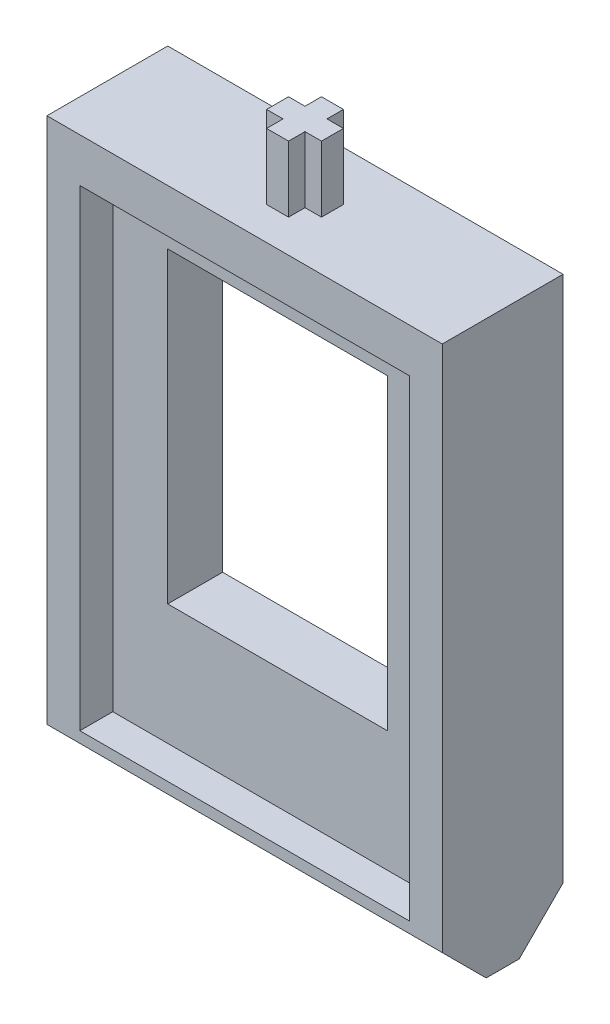
from build123d import *

# Parameters (mm, degrees)
SKETCH1_W           = 18
SKETCH1_H           = 26
BOSS_EXTRUDE1_DEPTH = 5.5
CHAMFER1_SIZE       = 2
SKETCH3_W           = 15
SKETCH3_H           = 21.5
CUT_EXTRUDE1_DEPTH  = 1.5
SKETCH4_W           = 10
SKETCH4_H           = 14
CUT_EXTRUDE2_DEPTH  = 61.5
BOSS_EXTRUDE2_DEPTH = 3


with BuildPart() as part:
    # Sketch1 → Boss-Extrude1 (new body)
    with BuildSketch(Plane.XY):
        Rectangle(SKETCH1_W, SKETCH1_H)
    extrude(amount=BOSS_EXTRUDE1_DEPTH)

    # Chamfer1
    chamfer1_edges = [part.edges().sort_by_distance(p)[0] for p in [
        (0, -13, 0),
        (0, -13, 5.5),
    ]]
    chamfer(chamfer1_edges, length=CHAMFER1_SIZE)

    # Sketch3 → Cut-Extrude1 (cut)
    with BuildSketch(Plane.XY.offset(5.5)):
        with Locations((0, 0.25)):
            Rectangle(SKETCH3_W, SKETCH3_H)
    cut_extrude1 = extrude(amount=-CUT_EXTRUDE1_DEPTH, mode=Mode.SUBTRACT)

    # Mirror1: Cut-Extrude1 across plane
    add(cut_extrude1.mirror(Plane.XY.offset(2.75)), mode=Mode.SUBTRACT)

    # Sketch4 → Cut-Extrude2 (cut)
    with BuildSketch(Plane(origin=(0, 0, 1.5), x_dir=(-1, 0, 0), z_dir=(0, 0, -1))):
        with Locations((0, 2)):
            Rectangle(SKETCH4_W, SKETCH4_H)
    extrude(amount=-CUT_EXTRUDE2_DEPTH, mode=Mode.SUBTRACT)

    # Sketch2 → Boss-Extrude2 (add)
    with BuildSketch(Plane(origin=(0, 13, 0), x_dir=(1, 0, 0), z_dir=(0, 1, 0))):
        Polygon((-0.5, -1.5), (0.5, -1.5), (0.5, -2.25), (1.25, -2.25), (1.25, -3.25), (0.5, -3.25), (0.5, -4), (-0.5, -4), (-0.5, -3.25), (-1.25, -3.25), (-1.25, -2.25), (-0.5, -2.25), align=None)
    extrude(amount=BOSS_EXTRUDE2_DEPTH)


solid = part.part
